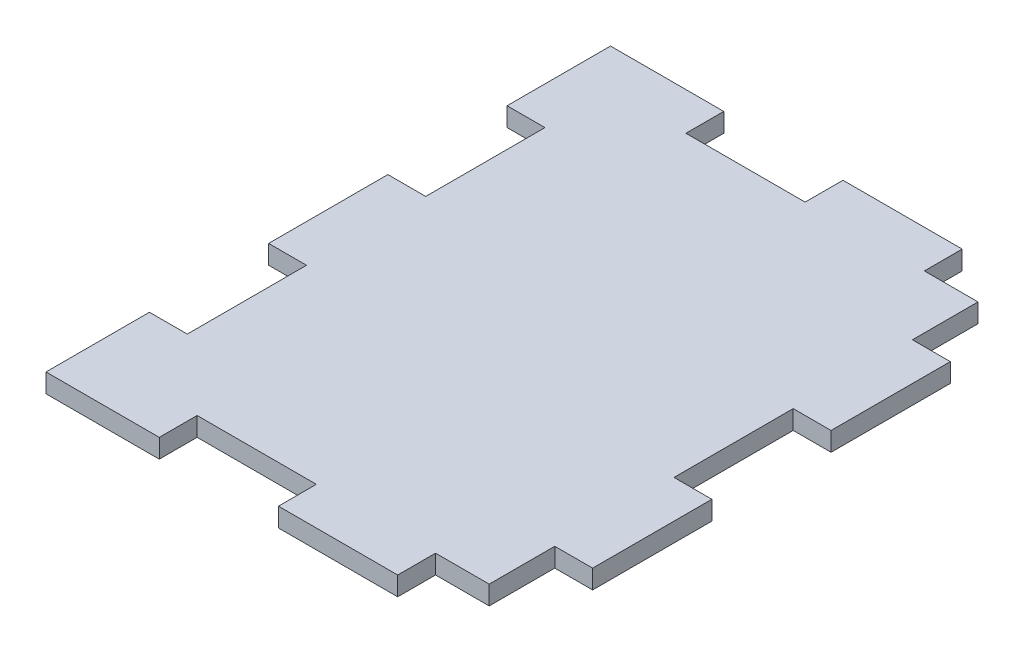
from build123d import *

# Parameters (mm, degrees)
SKETCH1_W           = 37.175
SKETCH1_H           = 47.35
BOSS_EXTRUDE1_DEPTH = 1.5875
SKETCH2_W           = 3.175
SKETCH2_H           = 10
SKETCH2_W_2         = 10
SKETCH2_H_2         = 3.175
CUT_EXTRUDE1_DEPTH  = 61.220621728


with BuildPart() as part:
    # Sketch1 → Boss-Extrude1 (new body)
    with BuildSketch(Plane(origin=(0, 0, 0), x_dir=(1, 0, 0), z_dir=(0, 1, 0))):
        with Locations((18.5875, 23.675)):
            Rectangle(SKETCH1_W, SKETCH1_H)
    extrude(amount=BOSS_EXTRUDE1_DEPTH)

    # Sketch2 → Cut-Extrude1 (cut, through all)
    with BuildSketch(Plane(origin=(0, 1.5875, 0), x_dir=(1, 0, 0), z_dir=(0, 1, 0))):
        with Locations((1.5875, 33.675)):
            Rectangle(SKETCH2_W, SKETCH2_H)
        with Locations((1.5875, 13.675)):
            Rectangle(SKETCH2_W, SKETCH2_H)
        with Locations((14.5, 45.7625)):
            Rectangle(SKETCH2_W_2, SKETCH2_H_2)
        Polygon((37.175, 47.35), (29.5, 47.35), (29.5, 44.175), (34, 44.175), (34, 38.675), (37.175, 38.675), align=None)
        with Locations((14.5, 1.5875)):
            Rectangle(SKETCH2_W_2, SKETCH2_H_2)
        Polygon((29.5, 3.175), (29.5, 0), (37.175, 0), (37.175, 8.675), (34, 8.675), (34, 3.175), align=None)
        with Locations((35.5875, 23.675)):
            Rectangle(SKETCH2_W, SKETCH2_H)
    extrude(amount=-CUT_EXTRUDE1_DEPTH, mode=Mode.SUBTRACT)


solid = part.part
